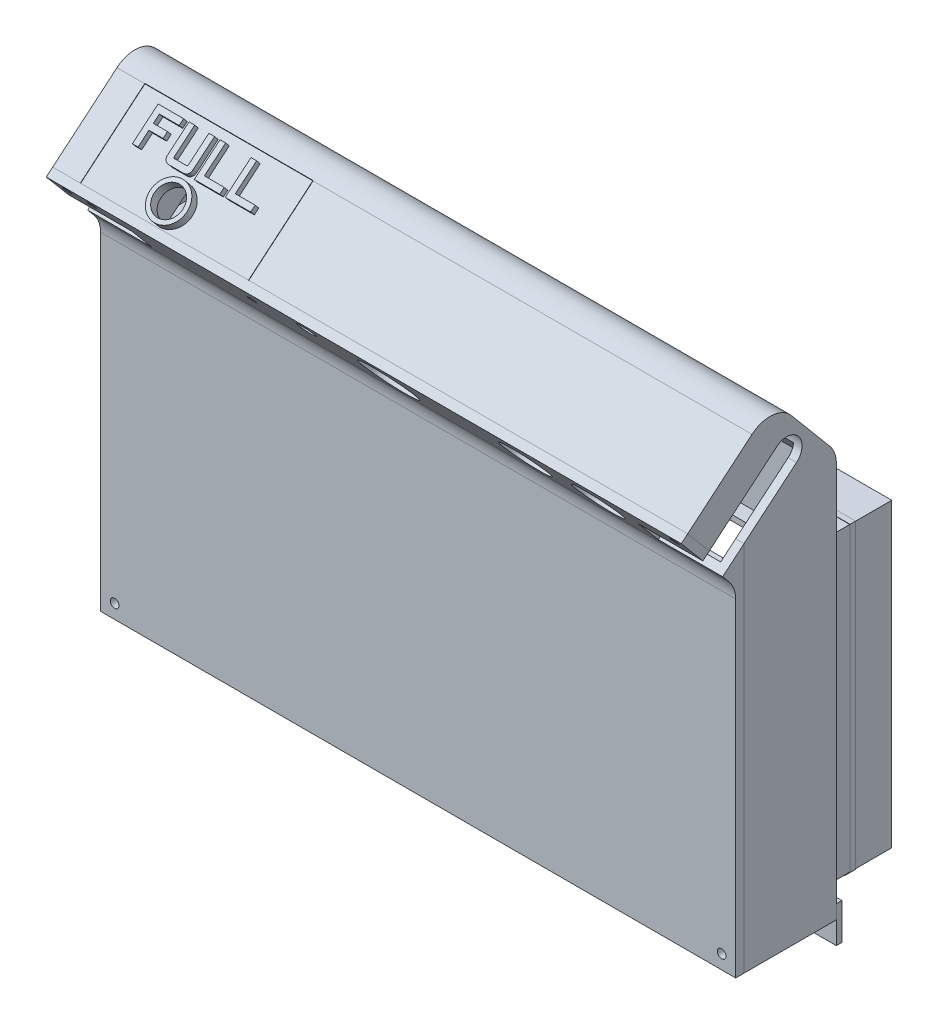
from build123d import *
from build123d.topology import SkipClean

# Parameters (mm, degrees)
SKETCH_1_W            = 227
SKETCH_1_H            = 145
SKETCH_1_W_2          = 221
SKETCH_1_H_2          = 139
EXTRUDE_1_DEPTH       = 30
SKETCH_1_2_W          = 227
SKETCH_1_2_H          = 145
SKETCH_1_2_W_2        = 221
SKETCH_1_2_H_2        = 139
EXTRUDE_2_DEPTH       = 3
EXTRUDE_START         = -227
EXTRUDE_3_DEPTH       = 227
CUT_EXTRUDE_START     = -227
SKETCH_2_3_R          = 5.5
CUT_EXTRUDE_1_DEPTH   = 227
SKETCH_3_W            = 221
SKETCH_3_H            = 35.33282852
CUT_EXTRUDE_2_DEPTH   = 33
SKETCH_4_W            = 181
SKETCH_4_H            = 33
EXTRUDE_4_DEPTH       = 4.667171
SKETCH_5_R            = 1.55
EXTRUDE_6_DEPTH       = 3
SKETCH_6_W            = 4
SKETCH_6_H            = 4
SKETCH_6_R            = 1.5
EXTRUDE_7_DEPTH       = 35.332829
SKETCH_7_W            = 227
SKETCH_7_H            = 124.8200586
SKETCH_7_R            = 1.55
EXTRUDE_8_DEPTH       = 3
EXTRUDE_9_DEPTH       = 3
EXTRUDE_10_DEPTH      = 3
SKETCH_10_W           = 217
SKETCH_10_H           = 110
CUT_EXTRUDE_3_DEPTH   = 3
SKETCH_11_R           = 9.4
SKETCH_11_R_2         = 8.1
CUT_EXTRUDE_4_DEPTH   = 3
SKETCH_13_R           = 3.05
SKETCH_13_R_2         = 1.5
CUT_EXTRUDE_5_DEPTH   = 4
EXTRUDE_11_DEPTH      = 30
SKETCH_15_W           = 60.2
SKETCH_15_H           = 30.1
CUT_EXTRUDE_6_DEPTH   = 2
EXTRUDE_12_DEPTH      = 2
SKETCH_17_W           = 43
SKETCH_17_H           = 28
CUT_EXTRUDE_7_DEPTH   = 7
SKETCH_21_W           = 4
SKETCH_21_H           = 4
SKETCH_21_R           = 1.55
EXTRUDE_14_DEPTH      = 33
SKETCH_22_W           = 4.177665322
SKETCH_22_H           = 4.547686259
SKETCH_22_W_2         = 3.647060057
SKETCH_22_H_2         = 3.843663111
EXTRUDE_15_DEPTH      = 7
SKETCH_23_W           = 60
SKETCH_23_H           = 30
EXTRUDE_16_DEPTH      = 0.6
EXTRUDE_18_DEPTH      = 2
SKETCH_27_W           = 227
SKETCH_27_H           = 13
SKETCH_27_R           = 1.5
EXTRUDE_19_DEPTH      = 2
SKETCH_27_2_R         = 1.5
CUT_EXTRUDE_9_DEPTH   = 10
SKETCH_28_W           = 5
SKETCH_28_H           = 5
EXTRUDE_21_DEPTH      = 25
EXTRUDE_22_DEPTH      = 25
EXTRUDE_22_DEPTH_BACK = 8
EXTRUDE_23_DEPTH      = 2
FILLET_1_R            = 10
FILLET_2_R            = 10
FILLET_3_R            = 10
SKETCH_32_R           = 5.1
CUT_EXTRUDE_10_DEPTH  = 5
SKETCH_33_R           = 6.6
SKETCH_33_R_2         = 5.1
EXTRUDE_26_DEPTH      = 3
EXTRUDE_27_DEPTH      = 2
EXTRUDE_27_2_DEPTH    = 2
EXTRUDE_27_3_DEPTH    = 2
EXTRUDE_27_4_DEPTH    = 2


with BuildPart() as part:
    # 스케치1 → 보스-돌출1 (new body)
    with BuildSketch(Plane.XY):
        with Locations((8.565406147, -0.100137348)):
            Rectangle(SKETCH_1_W, SKETCH_1_H)
        with Locations((8.565406147, -0.100137348)):
            Rectangle(SKETCH_1_W_2, SKETCH_1_H_2, mode=Mode.SUBTRACT)
    extrude(amount=EXTRUDE_1_DEPTH)

    # 스케치1<2> → 보스-돌출2 (add)
    # profile 1 of 2: a face of its own
    with BuildSketch(Plane.XY):
        with Locations((8.565406147, -0.100137348)):
            Rectangle(SKETCH_1_2_W, SKETCH_1_2_H)
        with Locations((8.565406147, -0.100137348)):
            Rectangle(SKETCH_1_2_W_2, SKETCH_1_2_H_2, mode=Mode.SUBTRACT)
    # profile 2 of 2: a face of its own
    with BuildSketch(Plane.XY):
        with Locations((8.565406147, -0.100137348)):
            Rectangle(SKETCH_1_2_W_2, SKETCH_1_2_H_2)
    extrude(amount=-EXTRUDE_2_DEPTH)

    # 스케치2 → 보스-돌출3 (add)
    with BuildSketch(Plane(origin=(122.065406147, 0, 0), x_dir=(0, 0, -1), z_dir=(1, 0, 0)).offset(EXTRUDE_START)):
        with BuildLine():
            Line((-10.546916445, 83.877277514), (-21.795699668, 97.283055332))
            Line((-21.795699668, 97.283055332), (-50.139344064, 73.499913774))
            Line((-50.139344064, 73.499913774), (-42.425892748, 64.307380457))
            Line((-42.425892748, 64.307380457), (-18.295492789, 84.555190162))
            ThreePointArc((-18.295492789, 84.555190162), (-14.280804309, 85.82101656), (-10.546916445, 83.877277514))
        make_face()
        Polygon((-27.641777725, 46.688358265), (3, 72.399862652), (-0.916221868, 72.399862652), (-15.668685922, 72.399862652), (-30, 60.374462295), (-30, 49.498778134), align=None)
        with BuildLine():
            Line((-15.668685922, 72.399862652), (-0.916221868, 72.399862652))
            Line((-0.916221868, 72.399862652), (-10.546916445, 83.877277514))
            ThreePointArc((-10.546916445, 83.877277514), (-9.591851507, 82.223056474), (-9.260160936, 80.341945725))
            ThreePointArc((-9.260160936, 80.341945725), (-9.775468107, 78.017545285), (-11.224829083, 76.128701287))
            Line((-11.224829083, 76.128701287), (-15.668685922, 72.399862652))
        make_face()
        Polygon((-0.916221868, 72.399862652), (3, 72.399862652), (-19.497566339, 99.211418162), (-21.795699668, 97.283055332), (-10.546916445, 83.877277514), align=None)
    extrude(amount=EXTRUDE_3_DEPTH)

    # 스케치2<3> → 컷-돌출1 (cut)
    with BuildSketch(Plane(origin=(122.065406147, 0, 0), x_dir=(0, 0, -1), z_dir=(1, 0, 0)).offset(CUT_EXTRUDE_START)):
        with BuildLine():
            Line((-30, 72.399862652), (-15.668685922, 72.399862652))
            Line((-15.668685922, 72.399862652), (-11.224829083, 76.128701287))
            ThreePointArc((-11.224829083, 76.128701287), (-18.973405373, 76.806613871), (-18.295492789, 84.555190162))
            Line((-18.295492789, 84.555190162), (-42.425892748, 64.307380457))
            Line((-42.425892748, 64.307380457), (-35.355229041, 55.880891582))
            Line((-35.355229041, 55.880891582), (-30, 60.374462295))
            Line((-30, 60.374462295), (-30, 72.399862652))
        make_face()
        Polygon((-30, 60.374462295), (-15.668685922, 72.399862652), (-30, 72.399862652), align=None)
        with Locations((-14.760160936, 80.341945725)):
            Circle(SKETCH_2_3_R)
        Polygon((-39.82217405, 52.132679673), (-35.355229041, 55.880891582), (-42.425892748, 64.307380457), (-46.892837757, 60.559168547), align=None)
    extrude(amount=CUT_EXTRUDE_1_DEPTH, mode=Mode.SUBTRACT)

    # 스케치3 → 컷-돌출2 (cut)
    with BuildSketch(Plane(origin=(0, 41.008771803, 34.410445295), x_dir=(1, 0, 0), z_dir=(0, -0.7660444431189797, -0.6427876096865376))):
        with Locations((8.565406147, -26.502282245)):
            Rectangle(SKETCH_3_W, SKETCH_3_H)
    extrude(amount=-CUT_EXTRUDE_2_DEPTH, mode=Mode.SUBTRACT)

    # 스케치4 → 보스-돌출4 (add)
    with BuildSketch(Plane(origin=(0, 28.391090849, -33.835184517), x_dir=(1, 0, 0), z_dir=(0, -0.6427876096865376, 0.7660444431189797))):
        with Locations((8.565406147, 70.033149638)):
            Rectangle(SKETCH_4_W, SKETCH_4_H)
    extrude(amount=-EXTRUDE_4_DEPTH)

    # 스케치6 → 보스-돌출7 (add)
    # profile 1 of 2: a face of its own
    with SkipClean():  # the faces are left unmerged after this step: merging them gives an invalid solid
        with BuildSketch(Plane(origin=(0, 28.391090849, -33.835184517), x_dir=(1, 0, 0), z_dir=(0, -0.6427876096865376, 0.7660444431189797))):
            with Locations((-99.934593853, 84.533149638)):
                Rectangle(SKETCH_6_W, SKETCH_6_H)
            with Locations(Location((-99.934593853, 84.533149638, 0), (0, 0, 270))):
                Circle(SKETCH_6_R, mode=Mode.SUBTRACT)
        # profile 2 of 2: a face of its own
        with BuildSketch(Plane(origin=(0, 28.391090849, -33.835184517), x_dir=(1, 0, 0), z_dir=(0, -0.6427876096865376, 0.7660444431189797))):
            with Locations((117.065406147, 84.533149638)):
                Rectangle(SKETCH_6_W, SKETCH_6_H)
            with Locations(Location((117.065406147, 84.533149638, 0), (0, 0, 270))):
                Circle(SKETCH_6_R, mode=Mode.SUBTRACT)
        extrude(amount=EXTRUDE_7_DEPTH)

    # 스케치10 → 컷-돌출3 (cut)
    with SkipClean():  # the faces are left unmerged after this step: merging them gives an invalid solid
        with BuildSketch(Plane(origin=(0, 0, -3), x_dir=(-1, 0, 0), z_dir=(0, 0, -1))):
            with Locations((-8.565406147, -12.600137348)):
                Rectangle(SKETCH_10_W, SKETCH_10_H)
        extrude(amount=-CUT_EXTRUDE_3_DEPTH, mode=Mode.SUBTRACT)

    # 스케치15 → 컷-돌출6 (cut)
    with SkipClean():  # the faces are left unmerged after this step: merging them gives an invalid solid
        with BuildSketch(Plane(origin=(0, 67.820327312, 56.908011634), x_dir=(1, 0, 0), z_dir=(0, 0.766044443118982, 0.6427876096865347))):
            with Locations((-64.934593853, 23.885867985)):
                Rectangle(SKETCH_15_W, SKETCH_15_H)
        extrude(amount=-CUT_EXTRUDE_6_DEPTH, mode=Mode.SUBTRACT)

    # 스케치21 → 보스-돌출14 (add)
    # profile 1 of 2: a face of its own
    with SkipClean():  # the faces are left unmerged after this step: merging them gives an invalid solid
        with BuildSketch(Plane(origin=(0, 0, 30), x_dir=(-1, 0, 0), z_dir=(0, 0, -1))):
            with Locations((-117.065406147, -67.600137348)):
                Rectangle(SKETCH_21_W, SKETCH_21_H)
            with Locations(Location((-117.065406147, -67.600137348, 0), (0, 0, 180))):
                Circle(SKETCH_21_R, mode=Mode.SUBTRACT)
        # profile 2 of 2: a face of its own
        with BuildSketch(Plane(origin=(0, 0, 30), x_dir=(-1, 0, 0), z_dir=(0, 0, -1))):
            with Locations((99.934593853, -67.600137348)):
                Rectangle(SKETCH_21_W, SKETCH_21_H)
            with Locations(Location((99.934593853, -67.600137348, 0), (0, 0, 180))):
                Circle(SKETCH_21_R, mode=Mode.SUBTRACT)
        extrude(amount=EXTRUDE_14_DEPTH)

    # 스케치22 → 보스-돌출15 (add)
    with SkipClean():  # the faces are left unmerged after this step: merging them gives an invalid solid
        with BuildSketch(Plane(origin=(0, 0, -3), x_dir=(-1, 0, 0), z_dir=(0, 0, -1))):
            with Locations((-117.154238808, -67.873980477)):
                Rectangle(SKETCH_22_W, SKETCH_22_H)
            with Locations((99.758123882, -67.521968904)):
                Rectangle(SKETCH_22_W_2, SKETCH_22_H_2)
        extrude(amount=-EXTRUDE_15_DEPTH)

    # 스케치27<2> → 컷-돌출9 (cut)
    with SkipClean():  # the faces are left unmerged after this step: merging them gives an invalid solid
        with BuildSketch(Plane(origin=(0, 0, -3), x_dir=(-1, 0, 0), z_dir=(0, 0, -1))):
            with Locations((-120.065406147, -70.600137348)):
                Circle(SKETCH_27_2_R)
            with Locations((102.934593853, -70.600137348)):
                Circle(SKETCH_27_2_R)
        extrude(amount=-CUT_EXTRUDE_9_DEPTH, mode=Mode.SUBTRACT)

    # 스케치28 → 보스-돌출21 (add)
    with SkipClean():  # the faces are left unmerged after this step: merging them gives an invalid solid
        with BuildSketch(Plane(origin=(0, 0, 30), x_dir=(-1, 0, 0), z_dir=(0, 0, -1))):
            with Locations((-116.565406147, 39.699862652)):
                Rectangle(SKETCH_28_W, SKETCH_28_H)
            with Locations((99.434593853, 39.699862652)):
                Rectangle(SKETCH_28_W, SKETCH_28_H)
            with Locations((-116.565406147, -62.900137348)):
                Rectangle(SKETCH_28_W, SKETCH_28_H)
            with Locations((99.434593853, -62.900137348)):
                Rectangle(SKETCH_28_W, SKETCH_28_H)
        extrude(amount=EXTRUDE_21_DEPTH)

    # 필렛1
    fillet_1_edges = [part.edges().sort_by_distance(p)[0] for p in [
        (8.565406147, 72.399862652, -3),
    ]]
    fillet(fillet_1_edges, radius=FILLET_1_R)

    # 필렛2
    # the kernel refuses this fillet: 10 mm, written as the material it takes off along each edge
    with BuildSketch(Plane(origin=(-129.934593853, 99.211418162, 19.497566339), x_dir=(0, -0.7660444431189818, -0.6427876096865348), z_dir=(1, 0, 0))) as fillet_2_piece_1:
        with BuildLine():
            CenterArc((FILLET_2_R, -FILLET_2_R), FILLET_2_R, 90, 90)
            Line((0, -FILLET_2_R), (0, 0))
            Line((0, 0), (FILLET_2_R, 0))
        make_face()
    extrude(amount=277, mode=Mode.SUBTRACT)


with BuildPart() as body_2:
    # 스케치5 → 보스-돌출6 (new body)
    # profile 1 of 2: a face of its own
    with BuildSketch(Plane(origin=(0, 5.679586462, -6.76866757), x_dir=(1, 0, 0), z_dir=(0, -0.6427876096865353, 0.7660444431189815))):
        Polygon((-81.934593853, 65.533149638), (-104.934593853, 65.533149638), (-104.934593853, 57.813587755), (122.065406147, 57.813587755), (122.065406147, 65.533149638), (99.065406147, 65.533149638), (99.065406147, 76.533149638), (119.065406147, 76.533149638), (119.065406147, 86.533149638), (-101.934593853, 86.533149638), (-101.934593853, 76.533149638), (-81.934593853, 76.533149638), align=None)
        with Locations(Location((-99.934593853, 84.533149638, 0), (0, 0, 270))):
            Circle(SKETCH_5_R, mode=Mode.SUBTRACT)
        with Locations(Location((117.065406147, 84.533149638, 0), (0, 0, 270))):
            Circle(SKETCH_5_R, mode=Mode.SUBTRACT)
    # profile 2 of 2: a face of its own
    with BuildSketch(Plane(origin=(0, 5.679586462, -6.76866757), x_dir=(1, 0, 0), z_dir=(0, -0.6427876096865353, 0.7660444431189815))):
        Polygon((-101.934593853, 86.533149638), (119.065406147, 86.533149638), (119.065406147, 76.533149638), (122.065406147, 76.533149638), (122.065406147, 88.533149638), (-104.934593853, 88.533149638), (-104.934593853, 76.533149638), (-101.934593853, 76.533149638), align=None)
    extrude(amount=EXTRUDE_6_DEPTH)

    # 스케치7 → 보스-돌출8 (add)
    with BuildSketch(Plane.XY.offset(30)):
        with Locations((8.565406147, -10.190108048)):
            Rectangle(SKETCH_7_W, SKETCH_7_H)
        with Locations((-99.934593853, -67.600137348)):
            Circle(SKETCH_7_R, mode=Mode.SUBTRACT)
        with Locations((117.065406147, -67.600137348)):
            Circle(SKETCH_7_R, mode=Mode.SUBTRACT)
    extrude(amount=EXTRUDE_8_DEPTH)

    # 스케치9 → 보스-돌출9 (add)
    with BuildSketch(Plane(origin=(122.065406147, 0, 0), x_dir=(0, 0, -1), z_dir=(1, 0, 0))):
        Polygon((-30, 60.374462295), (-37.65336237, 53.952528753), (-34.176472041, 49.808932212), (-30, 52.219921252), align=None)
    extrude(amount=-EXTRUDE_9_DEPTH)

    # 스케치8 → 보스-돌출10 (add)
    with BuildSketch(Plane.ZY.offset(104.934593853)):
        Polygon((30, 60.374462295), (37.65336237, 53.952528753), (34.176472041, 49.808932212), (30, 52.219921252), align=None)
    extrude(amount=-EXTRUDE_10_DEPTH)

    # 스케치11 → 컷-돌출4 (cut)
    with BuildSketch(Plane(origin=(0, 5.679586462, -6.76866757), x_dir=(-1, 0, 0), z_dir=(0, 0.6427876096865353, -0.7660444431189815))):
        with Locations(Location((-8.565406147, 74.683149638, 0), (0, 0, 90))):
            Circle(SKETCH_11_R)
        with Locations(Location((-57.006016989, 73.953625244, 0), (0, 0, 90))):
            Circle(SKETCH_11_R_2)
        with Locations(Location((-83.006016989, 73.953625244, 0), (0, 0, 90))):
            Circle(SKETCH_11_R_2)
    extrude(amount=-CUT_EXTRUDE_4_DEPTH, mode=Mode.SUBTRACT)

    # 스케치13 → 컷-돌출5 (cut)
    with BuildSketch(Plane(origin=(0, 5.679586462, -6.76866757), x_dir=(-1, 0, 0), z_dir=(0, 0.6427876096865353, -0.7660444431189815))):
        with Locations(Location((16.434593853, 81.533149638, 0), (0, 0, 90))):
            Circle(SKETCH_13_R)
        with Locations(Location((37.934593853, 78.533149638, 0), (0, 0, 90))):
            Circle(SKETCH_13_R_2)
        with Locations(Location((91.934593853, 83.533149638, 0), (0, 0, 90))):
            Circle(SKETCH_13_R_2)
    extrude(amount=-CUT_EXTRUDE_5_DEPTH, mode=Mode.SUBTRACT)

    # 필렛3
    fillet_3_edges = [body_2.edges().sort_by_distance(p)[0] for p in [
        (8.565406147, 48.406867431, 33),
    ]]
    fillet(fillet_3_edges, radius=FILLET_3_R)


with BuildPart() as body_3:
    # 스케치14 → 보스-돌출11 (new body)
    # profile 1 of 3: a face of its own
    with BuildSketch(Plane(origin=(0, 5.679586462, -6.76866757), x_dir=(-1, 0, 0), z_dir=(0, 0.6427876096865353, -0.7660444431189815))):
        Polygon((94.934593853, 76.533149638), (94.934593853, 88.533149638), (34.934593853, 88.533149638), (34.934593853, 68.533149638), (81.934593853, 68.533149638), (81.934593853, 76.533149638), align=None)
        with BuildLine():
            Line((36.934593853, 80.533149638), (36.934593853, 88.133149638))
            Line((36.934593853, 88.133149638), (92.934593853, 88.133149638))
            Line((92.934593853, 88.133149638), (92.934593853, 85.533149638))
            Line((92.934593853, 85.533149638), (92.934593853, 84.651183627))
            ThreePointArc((92.934593853, 84.651183627), (93.303900247, 84.145522074), (93.434593853, 83.533149638))
            ThreePointArc((93.434593853, 83.533149638), (93.303900247, 82.920777203), (92.934593853, 82.41511565))
            Line((92.934593853, 82.41511565), (92.934593853, 81.533149638))
            Line((92.934593853, 81.533149638), (92.934593853, 78.533149638))
            Line((92.934593853, 78.533149638), (79.934593853, 78.533149638))
            Line((79.934593853, 78.533149638), (79.934593853, 70.533149638))
            Line((79.934593853, 70.533149638), (36.934593853, 70.533149638))
            Line((36.934593853, 70.533149638), (36.934593853, 76.533149638))
            Line((36.934593853, 76.533149638), (36.934593853, 77.41511565))
            ThreePointArc((36.934593853, 77.41511565), (36.434593853, 78.533149638), (36.934593853, 79.651183627))
            Line((36.934593853, 79.651183627), (36.934593853, 80.533149638))
        make_face(mode=Mode.SUBTRACT)
    # profile 2 of 3: a face of its own
    with BuildSketch(Plane(origin=(0, 5.679586462, -6.76866757), x_dir=(-1, 0, 0), z_dir=(0, 0.6427876096865353, -0.7660444431189815))):
        with BuildLine():
            Line((39.934593853, 80.533149638), (36.934593853, 80.533149638))
            Line((36.934593853, 80.533149638), (36.934593853, 79.651183627))
            ThreePointArc((36.934593853, 79.651183627), (38.546966289, 79.902456032), (39.434593853, 78.533149638))
            ThreePointArc((39.434593853, 78.533149638), (38.546966289, 77.163843245), (36.934593853, 77.41511565))
            Line((36.934593853, 77.41511565), (36.934593853, 76.533149638))
            Line((36.934593853, 76.533149638), (39.934593853, 76.533149638))
            Line((39.934593853, 76.533149638), (39.934593853, 80.533149638))
        make_face()
    # profile 3 of 3: a face of its own
    with BuildSketch(Plane(origin=(0, 5.679586462, -6.76866757), x_dir=(-1, 0, 0), z_dir=(0, 0.6427876096865353, -0.7660444431189815))):
        with BuildLine():
            Line((92.934593853, 84.651183627), (92.934593853, 85.533149638))
            Line((92.934593853, 85.533149638), (89.934593853, 85.533149638))
            Line((89.934593853, 85.533149638), (89.934593853, 81.533149638))
            Line((89.934593853, 81.533149638), (92.934593853, 81.533149638))
            Line((92.934593853, 81.533149638), (92.934593853, 82.41511565))
            ThreePointArc((92.934593853, 82.41511565), (90.434593853, 83.533149638), (92.934593853, 84.651183627))
        make_face()
    extrude(amount=EXTRUDE_11_DEPTH)

    # 스케치16 → 보스-돌출12 (add)
    with BuildSketch(Plane(origin=(0, 24.963214752, -29.750000864), x_dir=(-1, 0, 0), z_dir=(0, 0.6427876096865355, -0.7660444431189815))):
        Polygon((81.934593853, 76.533149638), (94.934593853, 76.533149638), (94.934593853, 88.533149638), (34.934593853, 88.533149638), (34.934593853, 68.533149638), (81.934593853, 68.533149638), align=None)
    extrude(amount=-EXTRUDE_12_DEPTH)

    # 스케치17 → 컷-돌출7 (cut)
    with BuildSketch(Plane(origin=(0, 52.49943845, 44.05225944), x_dir=(1, 0, 0), z_dir=(0, -0.7660444431189815, -0.6427876096865355))):
        with Locations((-58.434593853, -22.835867985)):
            Rectangle(SKETCH_17_W, SKETCH_17_H)
    extrude(amount=-CUT_EXTRUDE_7_DEPTH, mode=Mode.SUBTRACT)

    # 스케치23 → 보스-돌출16 (add)
    with BuildSketch(Plane(origin=(0, 67.820327312, 56.908011634), x_dir=(1, 0, 0), z_dir=(0, 0.7660444431189815, 0.6427876096865355))):
        with Locations((-64.934593853, 23.835867985)):
            Rectangle(SKETCH_23_W, SKETCH_23_H)
    extrude(amount=-EXTRUDE_16_DEPTH)

    # 스케치32 → 컷-돌출10 (cut)
    with BuildSketch(Plane(origin=(0, 67.360700646, 56.522339068), x_dir=(1, 0, 0), z_dir=(0, -0.7660444431189815, -0.6427876096865355))):
        with Locations(Location((-66.934593853, -15.835867985, 0), (0, 0, 270))):
            Circle(SKETCH_32_R)
    extrude(amount=-CUT_EXTRUDE_10_DEPTH, mode=Mode.SUBTRACT)

    # 스케치33 → 보스-돌출26 (add)
    with BuildSketch(Plane(origin=(0, 67.820327312, 56.908011634), x_dir=(1, 0, 0), z_dir=(0, 0.7660444431189815, 0.6427876096865355))):
        with Locations(Location((-66.934593853, 15.835867985, 0), (0, 0, 90))):
            Circle(SKETCH_33_R)
        with Locations(Location((-66.934593853, 15.835867985, 0), (0, 0, 90))):
            Circle(SKETCH_33_R_2, mode=Mode.SUBTRACT)
    extrude(amount=EXTRUDE_26_DEPTH)


with BuildPart() as body_4:
    # 스케치26 → 보스-돌출18 (new body)
    with BuildSketch(Plane(origin=(0, 0, -15), x_dir=(-1, 0, 0), z_dir=(0, 0, -1))):
        Polygon((99.834593853, -65.500137348), (99.834593853, 42.299862652), (-116.965406147, 42.299862652), (-116.965406147, -65.500137348), (-114.965406147, -65.500137348), (-114.965406147, -67.500137348), (97.834593853, -67.500137348), (97.834593853, -65.500137348), align=None)
        Polygon((94.834593853, -60.500137348), (94.834593853, 37.299862652), (-111.965406147, 37.299862652), (-111.965406147, -60.500137348), (-109.965406147, -60.500137348), (-109.965406147, -62.500137348), (92.834593853, -62.500137348), (92.834593853, -60.500137348), align=None, mode=Mode.SUBTRACT)
    extrude(amount=-EXTRUDE_18_DEPTH)


with BuildPart() as body_5:
    # 스케치27 → 보스-돌출19 (new body)
    with BuildSketch(Plane(origin=(0, 0, -3), x_dir=(-1, 0, 0), z_dir=(0, 0, -1))):
        with Locations((-8.565406147, -74.100137348)):
            Rectangle(SKETCH_27_W, SKETCH_27_H)
        with Locations((-120.065406147, -70.600137348)):
            Circle(SKETCH_27_R, mode=Mode.SUBTRACT)
        with Locations((102.934593853, -70.600137348)):
            Circle(SKETCH_27_R, mode=Mode.SUBTRACT)
    extrude(amount=EXTRUDE_19_DEPTH)


with BuildPart() as body_6:
    # 스케치24 → 보스-돌출22 (new, two sides: drawn at the far end of the back side and taken through both)
    with BuildSketch(Plane(origin=(0, 0, -3), x_dir=(-1, 0, 0), z_dir=(0, 0, -1)).offset(-EXTRUDE_22_DEPTH_BACK)):
        Polygon((99.734593853, -65.400137348), (99.734593853, 42.199862652), (-116.865406147, 42.199862652), (-116.865406147, -65.400137348), (-114.865406147, -65.400137348), (-114.865406147, -67.400137348), (97.734593853, -67.400137348), (97.734593853, -65.400137348), align=None)
        Polygon((97.734593853, -63.400137348), (97.734593853, 40.199862652), (-114.865406147, 40.199862652), (-114.865406147, -63.400137348), (-112.865406147, -63.400137348), (-112.865406147, -65.400137348), (95.734593853, -65.400137348), (95.734593853, -63.400137348), align=None, mode=Mode.SUBTRACT)
    extrude(amount=EXTRUDE_22_DEPTH + EXTRUDE_22_DEPTH_BACK)

    # 스케치29 → 보스-돌출23 (add)
    with BuildSketch(Plane(origin=(0, 0, -28), x_dir=(-1, 0, 0), z_dir=(0, 0, -1))):
        Polygon((97.734593853, -65.400137348), (99.734593853, -65.400137348), (99.734593853, 42.199862652), (-116.865406147, 42.199862652), (-116.865406147, -65.400137348), (-114.865406147, -65.400137348), (-114.865406147, -67.400137348), (97.734593853, -67.400137348), align=None)
        Polygon((90.734593853, -58.400137348), (92.734593853, -58.400137348), (92.734593853, 35.199862652), (-109.865406147, 35.199862652), (-109.865406147, -58.400137348), (-107.865406147, -58.400137348), (-107.865406147, -60.400137348), (90.734593853, -60.400137348), align=None, mode=Mode.SUBTRACT)
    extrude(amount=-EXTRUDE_23_DEPTH)


with BuildPart() as body_7:
    # 스케치35 → 보스-돌출27 (new body)
    with BuildSketch(Plane(origin=(0, 67.820327312, 56.908011634), x_dir=(1, 0, 0), z_dir=(0, 0.7660444431189815, 0.6427876096865355))):
        Polygon((-77.5920497, 35.919078528), (-77.5920497, 33.856578528), (-84.678963762, 33.856578528), (-84.678963762, 31.044078528), (-79.616463762, 31.044078528), (-79.616463762, 28.981578528), (-84.678963762, 28.981578528), (-84.678963762, 23.919078528), (-86.703377825, 23.919078528), (-86.703377825, 35.919078528), align=None)
    extrude(amount=EXTRUDE_27_DEPTH)


with BuildPart() as body_8:
    # 스케치35 → Extrude 27 2 (new body)
    with BuildSketch(Plane(origin=(0, 67.820327312, 56.908011634), x_dir=(1, 0, 0), z_dir=(0, 0.7660444431189815, 0.6427876096865355))):
        with BuildLine():
            Line((-75.640877825, 35.919078528), (-73.616463762, 35.919078528))
            Line((-73.616463762, 35.919078528), (-73.616463762, 26.377086341))
            add(Edge.make_bspline(
                [(-73.616463762, 26.377086341), (-73.611049821, 26.325697453), (-73.600028945, 26.221087792), (-73.501620273, 26.092762704), (-73.370052043, 25.998371825), (-73.264423407, 25.987136741), (-73.212166887, 25.981578528)],
                knots=[0, 0, 0, 0, 0.976758897, 1.988336794, 3.004791473, 4, 4, 4, 4], degree=3))
            Line((-73.212166887, 25.981578528), (-68.958260637, 25.981578528))
            add(Edge.make_bspline(
                [(-68.958260637, 25.981578528), (-68.905862507, 25.986932987), (-68.800768103, 25.99767237), (-68.670692488, 26.094908443), (-68.570470167, 26.222484446), (-68.559353662, 26.32857663), (-68.553963762, 26.380016028)],
                knots=[0, 0, 0, 0, 0.992574471, 1.990796637, 3.025826328, 4, 4, 4, 4], degree=3))
            Line((-68.553963762, 26.380016028), (-68.553963762, 35.919078528))
            Line((-68.553963762, 35.919078528), (-66.5295497, 35.919078528))
            Line((-66.5295497, 35.919078528), (-66.5295497, 25.920055091))
            add(Edge.make_bspline(
                [(-66.5295497, 25.920055091), (-66.536158373, 25.77689921), (-66.548927705, 25.500292243), (-66.651230466, 25.105517824), (-66.832865095, 24.758029057), (-67.076241289, 24.456816241), (-67.379786399, 24.215516132), (-67.732363261, 24.042099491), (-68.129127783, 23.937776957), (-68.4087805, 23.925468521), (-68.553963762, 23.919078528)],
                knots=[0, 0, 0, 0, 1.071818899, 2.070977258, 3.026509059, 3.988656707, 4.951916471, 5.907364234, 6.913596511, 8, 8, 8, 8], degree=3))
            Line((-68.553963762, 23.919078528), (-73.616463762, 23.919078528))
            add(Edge.make_bspline(
                [(-73.616463762, 23.919078528), (-73.761649175, 23.92546753), (-74.041306035, 23.937774057), (-74.438041721, 24.04210988), (-74.79072138, 24.215479144), (-75.093883451, 24.456955786), (-75.338403832, 24.75716214), (-75.514703492, 25.106874876), (-75.622718678, 25.499647633), (-75.634688573, 25.776766007), (-75.640877825, 25.920055091)],
                knots=[0, 0, 0, 0, 1.086598946, 2.093012256, 3.048631915, 4.012064982, 4.974385732, 5.926749628, 6.927988268, 8, 8, 8, 8], degree=3))
            Line((-75.640877825, 25.920055091), (-75.640877825, 35.919078528))
        make_face()
    extrude(amount=EXTRUDE_27_2_DEPTH)


with BuildPart() as body_9:
    # 스케치35 → Extrude 27 3 (new body)
    with BuildSketch(Plane(origin=(0, 67.820327312, 56.908011634), x_dir=(1, 0, 0), z_dir=(0, 0.7660444431189815, 0.6427876096865355))):
        Polygon((-64.578377825, 35.919078528), (-62.553963762, 35.919078528), (-62.553963762, 25.981578528), (-55.4670497, 25.981578528), (-55.4670497, 23.919078528), (-64.578377825, 23.919078528), align=None)
    extrude(amount=EXTRUDE_27_3_DEPTH)


with BuildPart() as body_10:
    # 스케치35 → Extrude 27 4 (new body)
    with BuildSketch(Plane(origin=(0, 67.820327312, 56.908011634), x_dir=(1, 0, 0), z_dir=(0, 0.7660444431189815, 0.6427876096865355))):
        Polygon((-53.515877825, 35.919078528), (-51.491463762, 35.919078528), (-51.491463762, 25.981578528), (-44.4045497, 25.981578528), (-44.4045497, 23.919078528), (-53.515877825, 23.919078528), align=None)
    extrude(amount=EXTRUDE_27_4_DEPTH)


solid = Compound([part.part, body_2.part, body_3.part, body_4.part, body_5.part, body_6.part, body_7.part, body_8.part, body_9.part, body_10.part])
